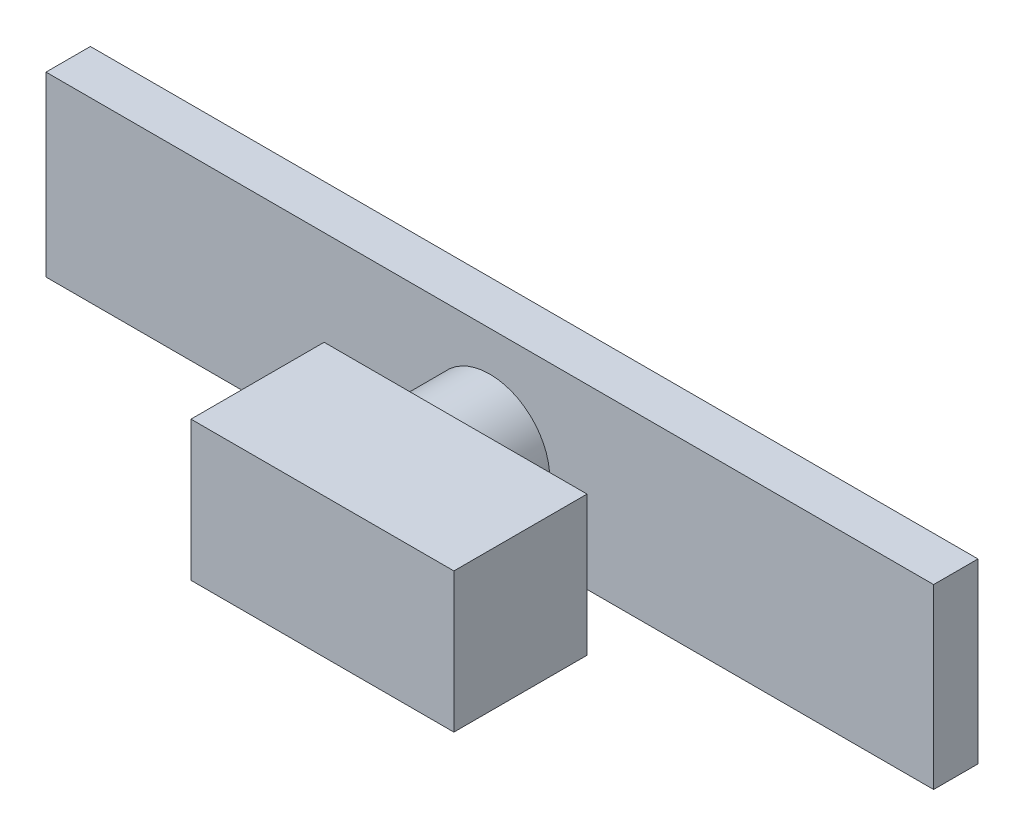
from build123d import *

# Parameters (mm, degrees)
SKETCH2_W             = 254
SKETCH2_H             = 12.7
BOSS_EXTRUDE1_DEPTH   = 50.8
SKETCH3_R             = 17.140791438
BOSS_EXTRUDE2_DEPTH   = 19.05
SKETCH4_W             = 75.235944222
SKETCH4_H             = 39.955088207
BOSS_EXTRUDE3_DEPTH   = 38.1
SCALE2_SCALE          = 0.06
BODY_MOVE_COPY1_ANGLE = 90
SCALE5_SCALE          = 0.25
SCALE6_SCALE          = 0.25


with BuildPart() as part:
    # Sketch2 → Boss-Extrude1 (new body)
    with BuildSketch(Plane.XY):
        with Locations((79.130769231, 14.898076923)):
            Rectangle(SKETCH2_W, SKETCH2_H)
    extrude(amount=BOSS_EXTRUDE1_DEPTH)

    # Sketch3 → Boss-Extrude2 (add)
    with BuildSketch(Plane(origin=(0, 21.248076923, 0), x_dir=(1, 0, 0), z_dir=(0, 1, 0))):
        with Locations((79.130769231, -28.483063876)):
            Circle(SKETCH3_R)
    extrude(amount=BOSS_EXTRUDE2_DEPTH)

    # Sketch4 → Boss-Extrude3 (add)
    with BuildSketch(Plane(origin=(0, 40.298076923, 0), x_dir=(1, 0, 0), z_dir=(0, 1, 0))):
        with Locations((88.38546847, -28.088530296)):
            Rectangle(SKETCH4_W, SKETCH4_H)
    extrude(amount=BOSS_EXTRUDE3_DEPTH)


with BuildPart() as part_1:
    # Scale2: scaled about (82.711857342, 33.041003565, 26.623476887)
    add(part.part.scale(SCALE2_SCALE).moved(Location((77.749145901, 31.058543351, 25.026068274))))


with BuildPart() as part_2:
    # Body-Move/Copy1: moved
    add(part_1.part.rotate(Axis((0, 33.666927966, 26.550068274), (1, 0, 0)), BODY_MOVE_COPY1_ANGLE))


with BuildPart() as part_3:
    # Body-Move/Copy3: moved
    add(part_2.part.moved(Location((-50.8, 0, -50.8))))


with BuildPart() as part_4:
    # Scale5: scaled about (31.911857342, 33.593519353, -24.875856127)
    add(part_3.part.scale(SCALE5_SCALE).moved(Location((23.933893006, 25.195139515, -18.656892095))))


with BuildPart() as part_5:
    # Body-Move/Copy9: moved
    add(part_4.part.moved(Location((-50.8, 0, 0))))


with BuildPart() as part_6:
    # Body-Move/Copy13: moved
    add(part_5.part.moved(Location((0, -50.8, 0))))


with BuildPart() as part_7:
    # Scale6: scaled about (-18.888142658, -17.206480647, -24.875856127)
    add(part_6.part.scale(SCALE6_SCALE).moved(Location((-14.166106993, -12.904860485, -18.656892095))))


with BuildPart() as part_8:
    # Body-Move/Copy16: moved
    add(part_7.part.moved(Location((0, 0, -12.7))))


with BuildPart() as part_9:
    # Body-Move/Copy17: moved
    add(part_8.part.moved(Location((0, 0, -76.2))))


with BuildPart() as part_10:
    # Body-Move/Copy18: moved
    add(part_9.part.moved(Location((0, 0, -254))))


solid = part_10.part
